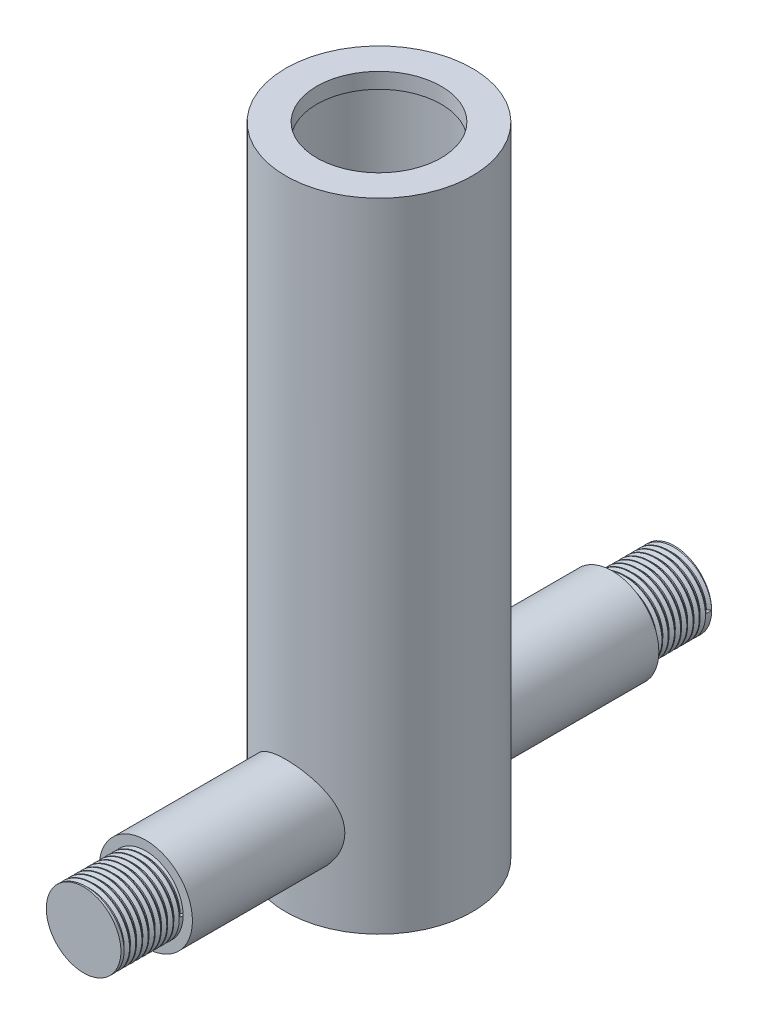
from build123d import *

# Parameters (mm, degrees)
SKETCH2_R           = 15
BOSS_EXTRUDE1_DEPTH = 75
SKETCH3_R           = 25
CUT_EXTRUDE1_DEPTH  = 100
SKETCH4_R           = 12
BOSS_EXTRUDE2_DEPTH = 20
THREAD1_PITCH       = 2
THREAD2_PITCH       = 2


with BuildPart() as part:
    # Sketch1 → Revolve1 (revolve)
    with BuildSketch(Plane.XY, mode=Mode.PRIVATE) as revolve1_sk:
        Polygon((0, -102.5), (0, 102.5), (-10, 102.5), (-10, 97.5), (-5, 97.5), (-5, -102.5), align=None)
    revolve(revolve1_sk.sketch.rotate(Axis((-30, 102.5, 0), (0, -1, 0)), 180), axis=Axis((-30, 102.5, 0), (0, -1, 0)))

    # Sketch2 → Boss-Extrude1 (add, symmetric)
    with BuildSketch(Plane.XY):
        with Locations(Location((-30, -75, 0), (0, 0, 180))):
            Circle(SKETCH2_R)
    extrude(amount=BOSS_EXTRUDE1_DEPTH, both=True)

    # Sketch3 → Cut-Extrude1 (cut)
    with BuildSketch(Plane.XZ.offset(102.5)):
        with Locations(Location((-30, 0, 0), (0, 0, 180))):
            Circle(SKETCH3_R)
    extrude(amount=-CUT_EXTRUDE1_DEPTH, mode=Mode.SUBTRACT)

    # Sketch4 → Boss-Extrude2 (add)
    with BuildSketch(Plane(origin=(0, 0, -75), x_dir=(-1, 0, 0), z_dir=(0, 0, -1))):
        with Locations((30, -75)):
            Circle(SKETCH4_R)
    boss_extrude2 = extrude(amount=BOSS_EXTRUDE2_DEPTH)

    # Mirror1: Boss-Extrude2 across plane
    add(boss_extrude2.mirror(Plane.XY))

    # Thread1: the profile of Thread Profile1 profile screwed along a right-hand helix of 9.5 turns, 10 arcs to a turn; built about Z, then put on its axis
    thread1_z = Axis((0, 0, 0), (0, 0, 1))
    thread1_corners = [(12.0003, 0, -0.000173205), (12.0003, 0, 1.7501732), (10.91746825, 0, 1.124999997), (10.91746825, 0, 0.624999997)]
    with BuildLine(mode=Mode.PRIVATE) as thread1_profile:
        Line(thread1_corners[0], thread1_corners[1])
        Line(thread1_corners[1], thread1_corners[2])
        Line(thread1_corners[2], thread1_corners[3])
        Line(thread1_corners[3], thread1_corners[0])
    thread1_cap = Face(thread1_profile.wire())
    thread1_turn_angles = [0, 18, 36, 54, 72, 90, 108, 126, 144, 162, 180, 198, 216, 234, 252, 270, 288, 306, 324, 342, 360]
    thread1_turn_weights = [1, 0.9510565162951535, 1, 0.9510565162951535, 1, 0.9510565162951535, 1, 0.9510565162951535, 1, 0.9510565162951535, 1, 0.9510565162951535, 1, 0.9510565162951535, 1, 0.9510565162951535, 1, 0.9510565162951535, 1, 0.9510565162951535, 1]
    thread1_turn_rails = [Edge.make_bspline([Vector(p[0], p[1], 0).rotate(thread1_z, thread1_turn_angles[k]) / thread1_turn_weights[k] + Vector(0, 0, p[2] + THREAD1_PITCH * thread1_turn_angles[k] / 360) for k in range(21)], [0, 0, 0, 1, 1, 2, 2, 3, 3, 4, 4, 5, 5, 6, 6, 7, 7, 8, 8, 9, 9, 10, 10, 10], 2, thread1_turn_weights) for p in thread1_corners]
    thread1_turn_sides = [Face.make_surface_from_curves(thread1_turn_rails[p[0]], thread1_turn_rails[p[1]]) for p in [(0, 1), (1, 2), (2, 3), (3, 0)]]
    thread1_last_angles = [3240, 3258, 3276, 3294, 3312, 3330, 3348, 3366, 3384, 3402, 3420]
    thread1_last_weights = [1, 0.9510565162951535, 1, 0.9510565162951535, 1, 0.9510565162951535, 1, 0.9510565162951535, 1, 0.9510565162951535, 1]
    thread1_last_rails = [Edge.make_bspline([Vector(p[0], p[1], 0).rotate(thread1_z, thread1_last_angles[k]) / thread1_last_weights[k] + Vector(0, 0, p[2] + THREAD1_PITCH * thread1_last_angles[k] / 360) for k in range(11)], [0, 0, 0, 1, 1, 2, 2, 3, 3, 4, 4, 5, 5, 5], 2, thread1_last_weights) for p in thread1_corners]
    thread1_last_sides = [Face.make_surface_from_curves(thread1_last_rails[p[0]], thread1_last_rails[p[1]]) for p in [(0, 1), (1, 2), (2, 3), (3, 0)]]
    thread1 = Plane(origin=(-30, -75, -95), x_dir=(1, 0, 0), z_dir=(0, 0, 1)) * Solid(Shell([*[p.moved(Location((0, 0, THREAD1_PITCH * i))) for i in range(9) for p in thread1_turn_sides], *thread1_last_sides, thread1_cap, thread1_cap.rotate(thread1_z, 3420).moved(Location((0, 0, THREAD1_PITCH * 3420 / 360)))]))
    add(thread1, mode=Mode.SUBTRACT)

    # Thread2: the profile of Thread Profile2 profile screwed along a right-hand helix of 9.5 turns, 10 arcs to a turn; built about Z, then put on its axis
    thread2_z = Axis((0, 0, 0), (0, 0, 1))
    thread2_corners = [(12.0003, 0, -0.000173205), (12.0003, 0, 1.7501732), (10.91746825, 0, 1.124999997), (10.91746825, 0, 0.624999997)]
    with BuildLine(mode=Mode.PRIVATE) as thread2_profile:
        Line(thread2_corners[0], thread2_corners[1])
        Line(thread2_corners[1], thread2_corners[2])
        Line(thread2_corners[2], thread2_corners[3])
        Line(thread2_corners[3], thread2_corners[0])
    thread2_cap = Face(thread2_profile.wire())
    thread2_turn_angles = [0, 18, 36, 54, 72, 90, 108, 126, 144, 162, 180, 198, 216, 234, 252, 270, 288, 306, 324, 342, 360]
    thread2_turn_weights = [1, 0.9510565162951535, 1, 0.9510565162951535, 1, 0.9510565162951535, 1, 0.9510565162951535, 1, 0.9510565162951535, 1, 0.9510565162951535, 1, 0.9510565162951535, 1, 0.9510565162951535, 1, 0.9510565162951535, 1, 0.9510565162951535, 1]
    thread2_turn_rails = [Edge.make_bspline([Vector(p[0], p[1], 0).rotate(thread2_z, thread2_turn_angles[k]) / thread2_turn_weights[k] + Vector(0, 0, p[2] + THREAD2_PITCH * thread2_turn_angles[k] / 360) for k in range(21)], [0, 0, 0, 1, 1, 2, 2, 3, 3, 4, 4, 5, 5, 6, 6, 7, 7, 8, 8, 9, 9, 10, 10, 10], 2, thread2_turn_weights) for p in thread2_corners]
    thread2_turn_sides = [Face.make_surface_from_curves(thread2_turn_rails[p[0]], thread2_turn_rails[p[1]]) for p in [(0, 1), (1, 2), (2, 3), (3, 0)]]
    thread2_last_angles = [3240, 3258, 3276, 3294, 3312, 3330, 3348, 3366, 3384, 3402, 3420]
    thread2_last_weights = [1, 0.9510565162951535, 1, 0.9510565162951535, 1, 0.9510565162951535, 1, 0.9510565162951535, 1, 0.9510565162951535, 1]
    thread2_last_rails = [Edge.make_bspline([Vector(p[0], p[1], 0).rotate(thread2_z, thread2_last_angles[k]) / thread2_last_weights[k] + Vector(0, 0, p[2] + THREAD2_PITCH * thread2_last_angles[k] / 360) for k in range(11)], [0, 0, 0, 1, 1, 2, 2, 3, 3, 4, 4, 5, 5, 5], 2, thread2_last_weights) for p in thread2_corners]
    thread2_last_sides = [Face.make_surface_from_curves(thread2_last_rails[p[0]], thread2_last_rails[p[1]]) for p in [(0, 1), (1, 2), (2, 3), (3, 0)]]
    thread2 = Plane(origin=(-30, -75, 95), x_dir=(-1, 0, 0), z_dir=(0, 0, -1)) * Solid(Shell([*[p.moved(Location((0, 0, THREAD2_PITCH * i))) for i in range(9) for p in thread2_turn_sides], *thread2_last_sides, thread2_cap, thread2_cap.rotate(thread2_z, 3420).moved(Location((0, 0, THREAD2_PITCH * 3420 / 360)))]))
    add(thread2, mode=Mode.SUBTRACT)


solid = part.part
